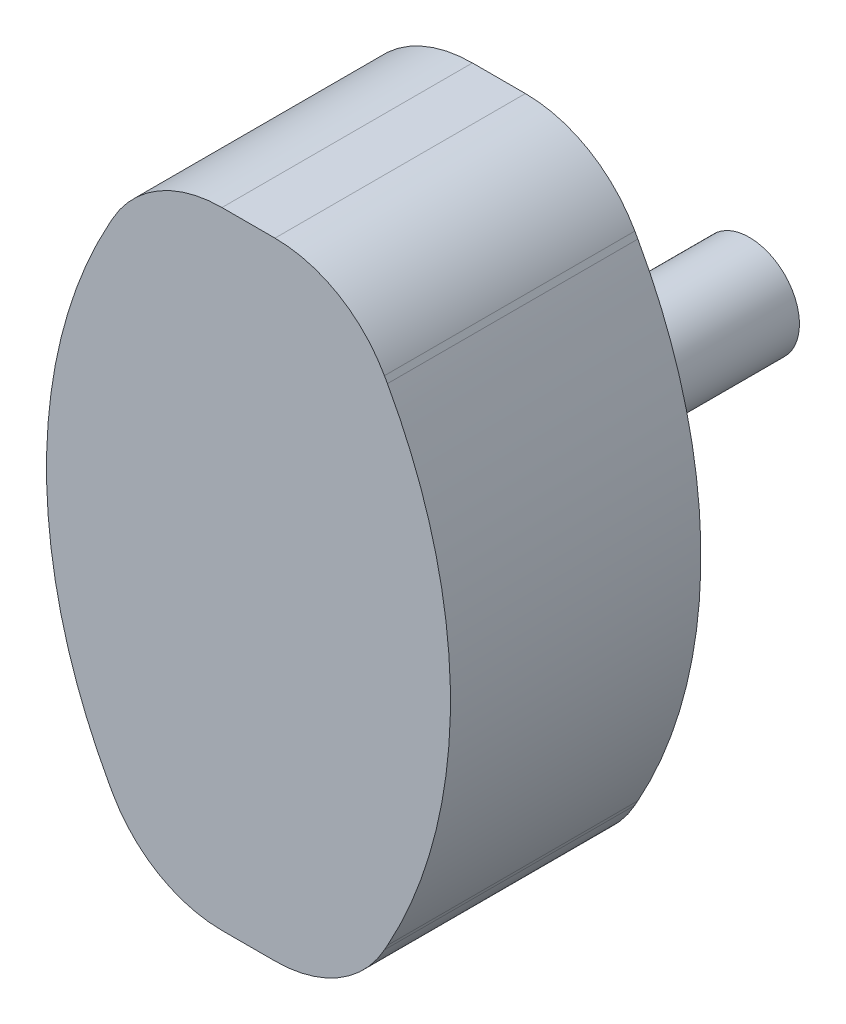
from build123d import *

# Parameters (mm, degrees)
RESSALTO_EXTRUS_O1_DEPTH = 10
ESBO_O2_R                = 2
RESSALTO_EXTRUS_O2_DEPTH = 10
FILETE1_R                = 5
FILETE2_R                = 2


with BuildPart() as part:
    # Esboço1 → Ressalto-extrusão1 (new body)
    with BuildSketch(Plane.XY):
        with BuildLine():
            Line((5.548411876, -9.712858624), (4, -12.5))
            Line((4, -12.5), (0, -12.5))
            Line((0, -12.5), (-4, -12.5))
            Line((-4, -12.5), (-5.548411876, -9.712858624))
            ThreePointArc((-5.548411876, -9.712858624), (-8.065266353, 0), (-5.548411876, 9.712858624))
            Line((-5.548411876, 9.712858624), (-4, 12.5))
            Line((-4, 12.5), (0, 12.5))
            Line((0, 12.5), (4, 12.5))
            Line((4, 12.5), (5.548411876, 9.712858624))
            ThreePointArc((5.548411876, 9.712858624), (8.065266353, 0), (5.548411876, -9.712858624))
        make_face()
    extrude(amount=RESSALTO_EXTRUS_O1_DEPTH)

    # Esboço2 → Ressalto-extrusão2 (add)
    with BuildSketch(Plane(origin=(0, 0, 0), x_dir=(-1, 0, 0), z_dir=(0, 0, -1))):
        Circle(ESBO_O2_R)
    extrude(amount=RESSALTO_EXTRUS_O2_DEPTH)

    # Filete1
    filete1_edges = [part.edges().sort_by_distance(p)[0] for p in [
        (-4, 12.5, 5),
        (4, 12.5, 5),
        (-4, -12.5, 5),
        (4, -12.5, 5),
    ]]
    fillet(filete1_edges, radius=FILETE1_R)

    # Filete2
    filete2_edges = [part.edges().sort_by_distance(p)[0] for p in [
        (2, 0, 0),
    ]]
    fillet(filete2_edges, radius=FILETE2_R)


solid = part.part
